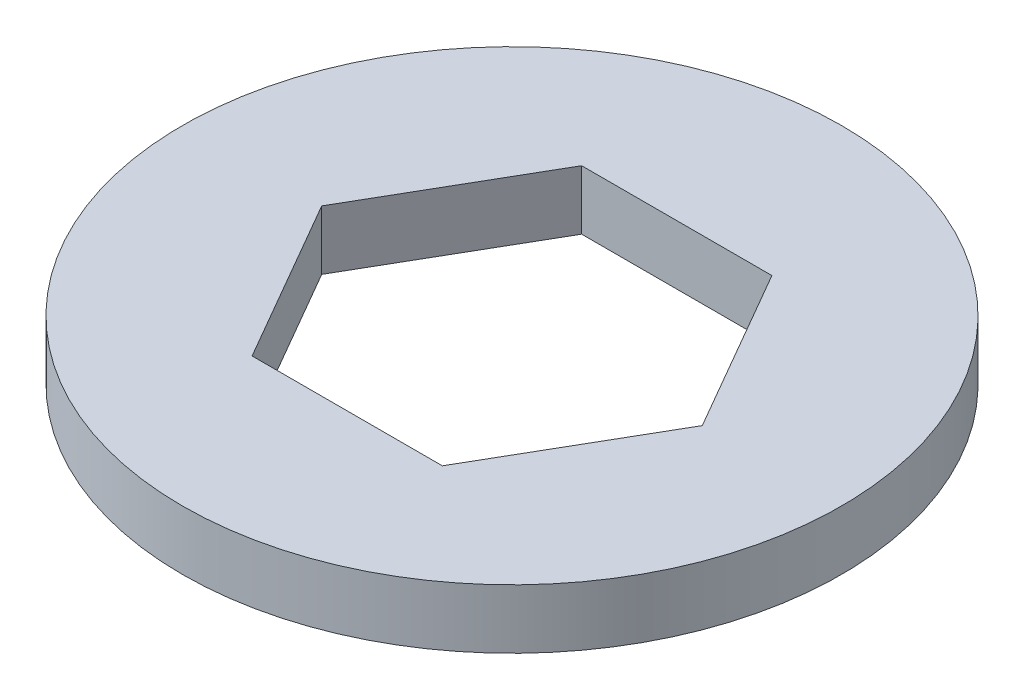
from build123d import *

# Parameters (mm, degrees)
SKETCH1_R           = 12.7
BOSS_EXTRUDE1_DEPTH = 1.143


with BuildPart() as part:
    # Sketch1 → Boss-Extrude1 (new, symmetric)
    with BuildSketch(Plane(origin=(0, 0, 0), x_dir=(1, 0, 0), z_dir=(0, 1, 0))):
        Circle(SKETCH1_R)
        Polygon((3.666174209, 6.35), (-3.666174209, 6.35), (-7.332348419, 0), (-3.666174209, -6.35), (3.666174209, -6.35), (7.332348419, 0), align=None, mode=Mode.SUBTRACT)
    extrude(amount=BOSS_EXTRUDE1_DEPTH, both=True)


solid = part.part
